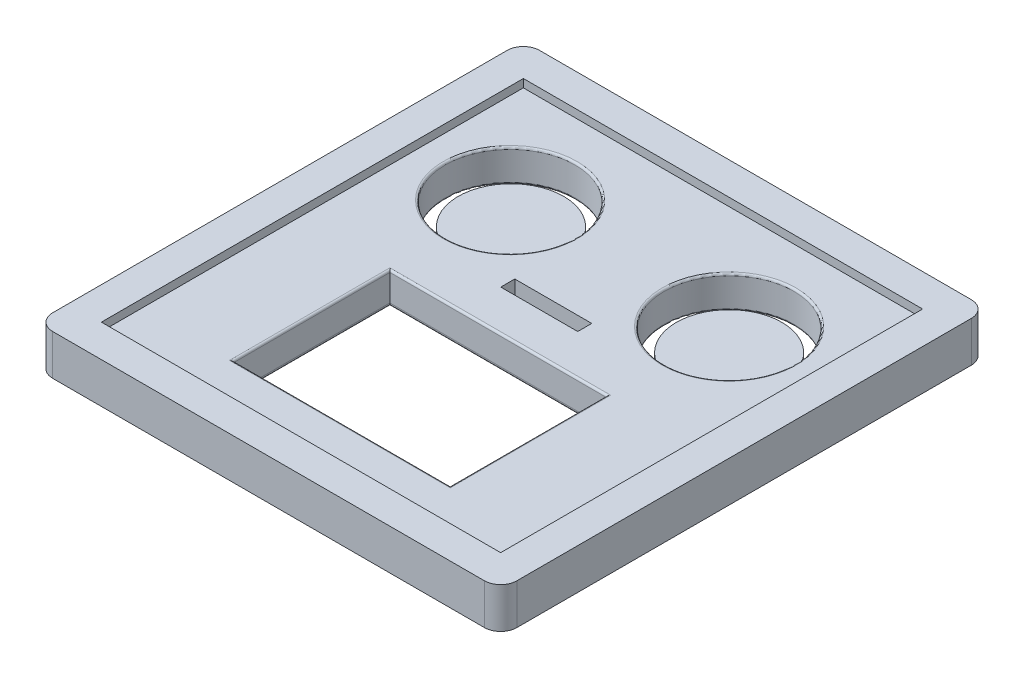
from build123d import *

# Parameters (mm, degrees)
ESQUISSE1_W              = 49.2
ESQUISSE1_H              = 52
BOSS_EXTRU_1_DEPTH       = 1
COQUE1_T                 = 4
CONG_1_R                 = 2
CONG_2_R                 = 2
CONG_3_R                 = 2
CONG_4_R                 = 2
EMPREINTE1_START         = -2.8
EMPREINTE1_OUTLINE_W     = 9.485715654
EMPREINTE1_OUTLINE_H     = 1.728890806
EMPREINTE1_OUTLINE_R     = 8
EMPREINTE1_DEPTH         = 2.8
EMPREINTE1_START_2       = -4
EMPREINTE1_2_OUTLINE_R   = 8
EMPREINTE1_2_OUTLINE_R_2 = 6.505433518
EMPREINTE1_2_OUTLINE_R_3 = 6.5
EMPREINTE1_2_DEPTH       = 1.2
EMPREINTE2_START         = -13.375027479
EMPREINTE2_OUTLINE_W     = 0.5
EMPREINTE2_OUTLINE_H     = 19.268
EMPREINTE2_DEPTH         = 26.7
ESQUISSE2_W              = 26.7
ESQUISSE2_H              = 19.268
ENL_V_MAT_EXTRU_1_DEPTH  = 10
CONG_5_R                 = 0.5
CONG_6_R                 = 0.25
CONG_7_R                 = 0.25
CONG_8_R                 = 0.25


# Read off the part's stored shape, not the designer's step: Empreinte1, Empreinte2
with BuildPart() as part:
    # Esquisse1 → Boss.-Extru.1 (new body)
    with BuildSketch(Plane(origin=(0, 0, 0), x_dir=(1, 0, 0), z_dir=(0, 1, 0))):
        Rectangle(ESQUISSE1_W, ESQUISSE1_H)
    extrude(amount=BOSS_EXTRU_1_DEPTH)

    # Coque1
    coque1_openings = [part.faces().sort_by_distance(p)[0] for p in [
        (0, 1, 0),
    ]]
    offset(amount=COQUE1_T, openings=coque1_openings, kind=Kind.INTERSECTION)

    # Congé1
    # the kernel refuses this fillet: 2 mm, written as the material it takes off along each edge
    with BuildSketch(Plane(origin=(28.6, -9, 30), x_dir=(-1, 0, 0), z_dir=(0, 1, 0))) as cong_1_piece_1:
        with BuildLine():
            CenterArc((CONG_1_R, -CONG_1_R), CONG_1_R, 90, 90)
            Line((0, -CONG_1_R), (0, 0))
            Line((0, 0), (CONG_1_R, 0))
        make_face()
    extrude(amount=15, mode=Mode.SUBTRACT)

    # Congé2
    cong_2_edges = [part.edges().sort_by_distance(p)[0] for p in [
        (28.6, -1.5, -30),
    ]]
    fillet(cong_2_edges, radius=CONG_2_R)

    # Congé3
    cong_3_edges = [part.edges().sort_by_distance(p)[0] for p in [
        (-28.6, -1.5, -30),
    ]]
    fillet(cong_3_edges, radius=CONG_3_R)

    # Congé4
    cong_4_edges = [part.edges().sort_by_distance(p)[0] for p in [
        (-28.6, -1.5, 30),
    ]]
    fillet(cong_4_edges, radius=CONG_4_R)

    # Empreinte1 outline → Empreinte1 (cut)
    with BuildSketch(Plane(origin=(0, 0, 0), x_dir=(1, 0, 0), z_dir=(0, 1, 0)).offset(EMPREINTE1_START)):
        with Locations((0.008688744, 4.212378703)):
            Rectangle(EMPREINTE1_OUTLINE_W, EMPREINTE1_OUTLINE_H)
        with Locations((-13.431637238, 13.206277507)):
            Circle(EMPREINTE1_OUTLINE_R)
        with Locations((13.548007164, 13.206277507)):
            Circle(EMPREINTE1_OUTLINE_R)
    extrude(amount=EMPREINTE1_DEPTH, mode=Mode.SUBTRACT)

    # Empreinte1 2 outline → Empreinte1 2 (cut)
    # profile 1 of 2: a face of its own
    with BuildSketch(Plane(origin=(0, 0, 0), x_dir=(1, 0, 0), z_dir=(0, 1, 0)).offset(EMPREINTE1_START_2)):
        with Locations((-13.431637238, 13.206277507)):
            Circle(EMPREINTE1_2_OUTLINE_R)
        with Locations((-13.331770872, 13.206277507)):
            Circle(EMPREINTE1_2_OUTLINE_R_2, mode=Mode.SUBTRACT)
    # profile 2 of 2: a face of its own
    with BuildSketch(Plane(origin=(0, 0, 0), x_dir=(1, 0, 0), z_dir=(0, 1, 0)).offset(EMPREINTE1_START_2)):
        with Locations((13.548007164, 13.206277507)):
            Circle(EMPREINTE1_2_OUTLINE_R)
        with Locations((13.548007164, 13.206277507)):
            Circle(EMPREINTE1_2_OUTLINE_R_3, mode=Mode.SUBTRACT)
    extrude(amount=EMPREINTE1_2_DEPTH, mode=Mode.SUBTRACT)

    # Empreinte2 outline → Empreinte2 (cut)
    with BuildSketch(Plane.YZ.offset(EMPREINTE2_START)):
        with Locations((-0.25, 11.304369063)):
            Rectangle(EMPREINTE2_OUTLINE_W, EMPREINTE2_OUTLINE_H)
    extrude(amount=EMPREINTE2_DEPTH, mode=Mode.SUBTRACT)

    # Esquisse2 → Enlèv. mat.-Extru.1 (cut)
    with BuildSketch(Plane(origin=(0, 0, 0), x_dir=(1, 0, 0), z_dir=(0, 1, 0))):
        with Locations((-0.025027479, -11.304369063)):
            Rectangle(ESQUISSE2_W, ESQUISSE2_H)
    extrude(amount=-ENL_V_MAT_EXTRU_1_DEPTH, mode=Mode.SUBTRACT)

    # Congé5
    cong_5_edges = [part.edges().sort_by_distance(p)[0] for p in [
        (-13.375027479, -4, 11.304369063),
        (-0.025027479, -4, 1.670369063),
        (13.324972521, -4, 11.304369063),
        (-0.025027479, -4, 20.938369063),
    ]]
    fillet(cong_5_edges, radius=CONG_5_R)

    # Congé6
    cong_6_edges = [part.edges().sort_by_distance(p)[0] for p in [
        (5.548007164, -4, -13.206277507),
        (-21.431637238, -4, -13.206277507),
    ]]
    fillet(cong_6_edges, radius=CONG_6_R)

    # Congé7
    cong_7_edges = [part.edges().sort_by_distance(p)[0] for p in [
        (-21.431637238, 0, -13.206277507),
        (5.548007164, 0, -13.206277507),
    ]]
    fillet(cong_7_edges, radius=CONG_7_R)

    # Congé8
    cong_8_edges = [part.edges().sort_by_distance(p)[0] for p in [
        (-0.025027479, 0, 1.670369063),
        (-13.375027479, 0, 11.304369063),
        (-0.025027479, 0, 20.938369063),
        (13.324972521, 0, 11.304369063),
    ]]
    fillet(cong_8_edges, radius=CONG_8_R)


solid = part.part
